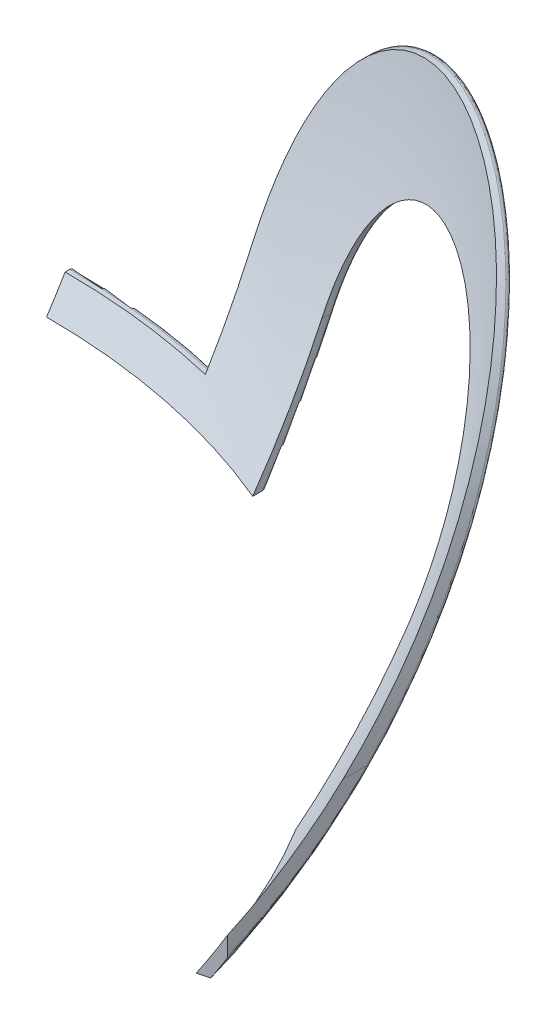
from build123d import *

# Parameters (mm, degrees)
REVOLVE1_ANGLE     = 75
CUT_EXTRUDE1_DEPTH = 390.903831419
FILLET1_R          = 1.27


with BuildPart() as part:
    # Sketch1 → Revolve1 (revolve)
    with BuildSketch(Plane(origin=(0, 0, 0), x_dir=(0, 0, -1), z_dir=(1, 0, 0))):
        with BuildLine():
            Line((230.505, -11.795080514), (234.28613444, -11.795080514))
            ThreePointArc((234.28613444, -11.795080514), (263.799017359, 52.075880233), (274.897350101, 121.554919486))
            Line((274.897350101, 121.554919486), (271.721629313, 121.554919486))
            ThreePointArc((271.721629313, 121.554919486), (260.45260116, 51.993275992), (230.505, -11.795080514))
        make_face()
    revolve(axis=Axis((0, 127, -17.78), (0, -1, 0)), revolution_arc=REVOLVE1_ANGLE)

    # Sketch2 → Cut-Extrude1 (cut, through all)
    with BuildSketch(Plane.XY):
        with BuildLine():
            add(Edge.make_bspline(
                [(213.36, -4.712274758), (246.966953148, 53.636042627), (248.35628885, 121.554919486)],
                knots=[1.033449564, 1.033449564, 1.033449564, 1.549622078, 1.549622078, 1.549622078], degree=2, weights=[0.995803699, 0.964806112, 1]))
            Line((248.35628885, 121.554919486), (0, 121.554919486))
            Line((0, 121.554919486), (0, -2.270080514))
            Line((0, -2.270080514), (50.8, -2.270080514))
            Line((50.8, -2.270080514), (50.8, 26.304919486))
            ThreePointArc((50.8, 26.304919486), (132.08, 107.584919486), (213.36, 26.304919486))
            Line((213.36, 26.304919486), (213.36, -4.712274758))
        make_face()
        with BuildLine():
            Line((82.55, -11.795080514), (181.61, -11.795080514))
            Line((181.61, -11.795080514), (181.61, 26.304919486))
            ThreePointArc((181.61, 26.304919486), (132.08, 75.834919486), (82.55, 26.304919486))
            Line((82.55, 26.304919486), (82.55, -11.795080514))
        make_face()
    extrude(amount=-CUT_EXTRUDE1_DEPTH, mode=Mode.SUBTRACT)

    # Fillet1
    fillet1_edges = [part.edges().sort_by_distance(p)[0] for p in [
        (25.569673431, -2.270080514, -238.629312223),
        (213.36, 8.620216721, -99.037110063),
        (148.74121332, 105.858941186, -226.509700128),
        (50.8, 11.783312592, -242.019727898),
        (82.55, 6.767706682, -229.602269293),
        (139.725317673, 75.241306953, -227.391197031),
        (181.61, 6.06492839, -153.910441047),
    ]]
    fillet(fillet1_edges, radius=FILLET1_R)


solid = part.part
